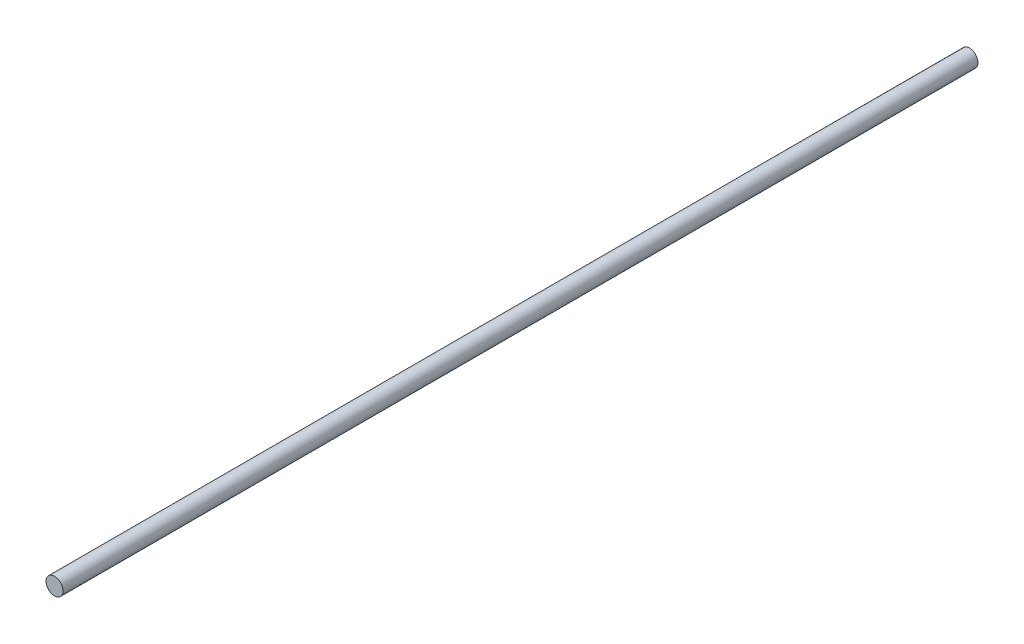
from build123d import *

# Parameters (mm, degrees)
SKETCH2_W = 430
SKETCH2_H = 4


with BuildPart() as part:
    # Sketch2 → Revolve1 (revolve)
    with BuildSketch(Plane(origin=(0, 0, 0), x_dir=(0, 0, -1), z_dir=(1, 0, 0))):
        with Locations((215, 2)):
            Rectangle(SKETCH2_W, SKETCH2_H)
    revolve(axis=Axis((0, 0, 0), (0, 0, -1)))


solid = part.part
